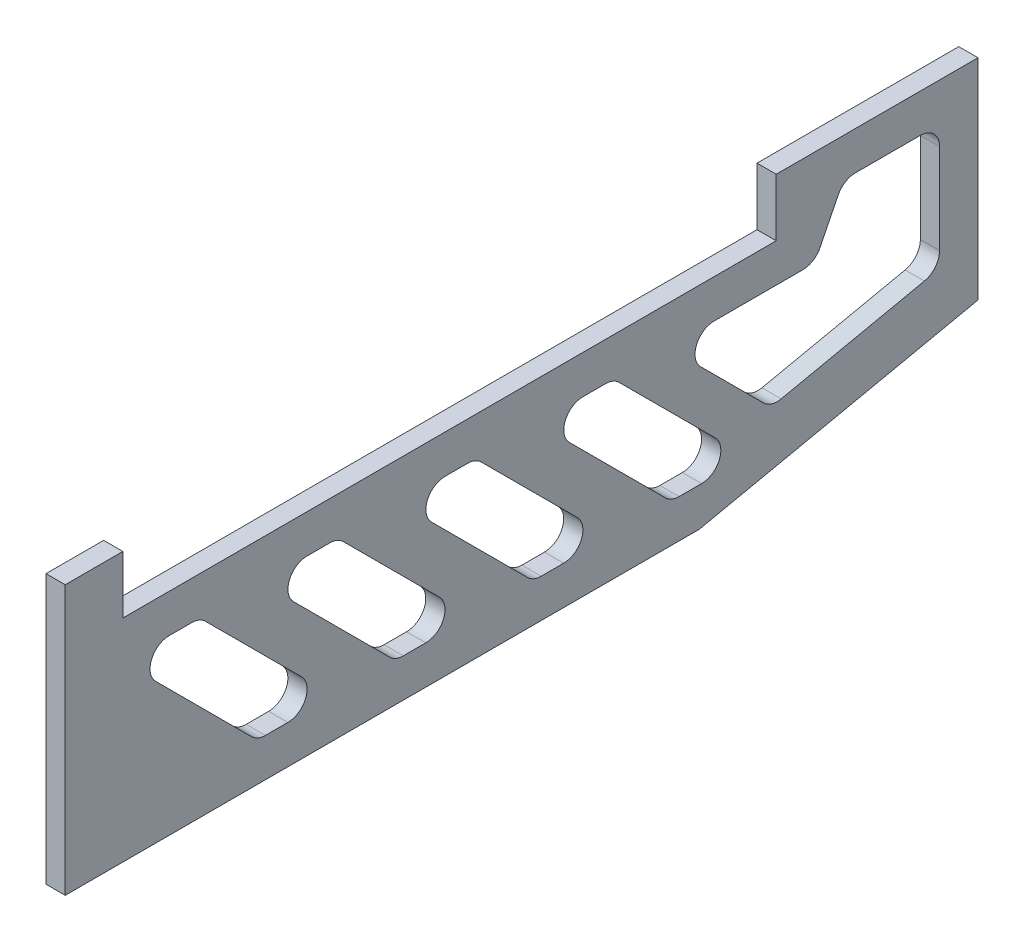
from build123d import *

# Parameters (mm, degrees)
SKIZZE1_W                       = 237.5
SKIZZE1_H                       = 70
AUFSATZ_LINEAR_AUSTRAGEN1_DEPTH = 5
SCHNITT_LINEAR_AUSTRAGEN1_DEPTH = 248.651468802
SKIZZE3_W                       = 170
SKIZZE3_H                       = 15
SCHNITT_LINEAR_AUSTRAGEN2_DEPTH = 5
SCHNITT_LINEAR_AUSTRAGEN3_DEPTH = 248.651468802
VERRUNDUNG1_R                   = 5


with BuildPart() as part:
    # Skizze1 → Aufsatz-Linear austragen1 (new body)
    with BuildSketch(Plane(origin=(0, 0, 0), x_dir=(0, 0, -1), z_dir=(1, 0, 0))):
        with Locations((118.75, 35)):
            Rectangle(SKIZZE1_W, SKIZZE1_H)
    extrude(amount=AUFSATZ_LINEAR_AUSTRAGEN1_DEPTH)

    # Skizze2 → Schnitt-Linear austragen1 (cut, through all)
    with BuildSketch(Plane(origin=(5, 0, 0), x_dir=(0, 0, -1), z_dir=(1, 0, 0))):
        Polygon((165, 0), (237.5, 15.410350721), (237.5, 0), align=None)
    extrude(amount=-SCHNITT_LINEAR_AUSTRAGEN1_DEPTH, mode=Mode.SUBTRACT)

    # Skizze3 → Schnitt-Linear austragen2 (cut)
    with BuildSketch(Plane(origin=(5, 0, 0), x_dir=(0, 0, -1), z_dir=(1, 0, 0))):
        with Locations((100, 62.5)):
            Rectangle(SKIZZE3_W, SKIZZE3_H)
    extrude(amount=-SCHNITT_LINEAR_AUSTRAGEN2_DEPTH, mode=Mode.SUBTRACT)

    # Skizze4 → Schnitt-Linear austragen3 (cut, through all)
    with BuildSketch(Plane(origin=(5, 0, 0), x_dir=(0, 0, -1), z_dir=(1, 0, 0))):
        Polygon((15, 45), (50, 10), (70, 10), (35, 45), align=None)
        Polygon((50.884510848, 45), (70.884510848, 45), (105.884510848, 10), (85.884510848, 10), align=None)
        Polygon((86.769021696, 45), (106.769021696, 45), (141.769021696, 10), (121.769021696, 10), align=None)
        Polygon((122.653532545, 45), (142.653532545, 45), (177.653532545, 10), (157.653532545, 10), align=None)
        Polygon((227.5, 60), (227.5, 27.5), (183.622185543, 18.173482625), (156.795668168, 45), (195, 45), (202.5, 60), align=None)
    extrude(amount=-SCHNITT_LINEAR_AUSTRAGEN3_DEPTH, mode=Mode.SUBTRACT)

    # Verrundung1
    verrundung1_edges = [part.edges().sort_by_distance(p)[0] for p in [
        (2.5, 10, -157.653532545),
        (2.5, 10, -177.653532545),
        (2.5, 45, -142.653532545),
        (2.5, 45, -122.653532545),
        (2.5, 45, -86.769021696),
        (2.5, 45, -106.769021696),
        (2.5, 10, -141.769021696),
        (2.5, 10, -121.769021696),
        (2.5, 10, -85.884510848),
        (2.5, 10, -105.884510848),
        (2.5, 45, -70.884510848),
        (2.5, 45, -50.884510848),
        (2.5, 10, -50),
        (2.5, 10, -70),
        (2.5, 45, -35),
        (2.5, 45, -15),
        (2.5, 18.173482625, -183.622185543),
        (2.5, 27.5, -227.5),
        (2.5, 60, -227.5),
        (2.5, 45, -195),
        (2.5, 60, -202.5),
        (2.5, 45, -156.795668168),
    ]]
    fillet(verrundung1_edges, radius=VERRUNDUNG1_R)


solid = part.part
